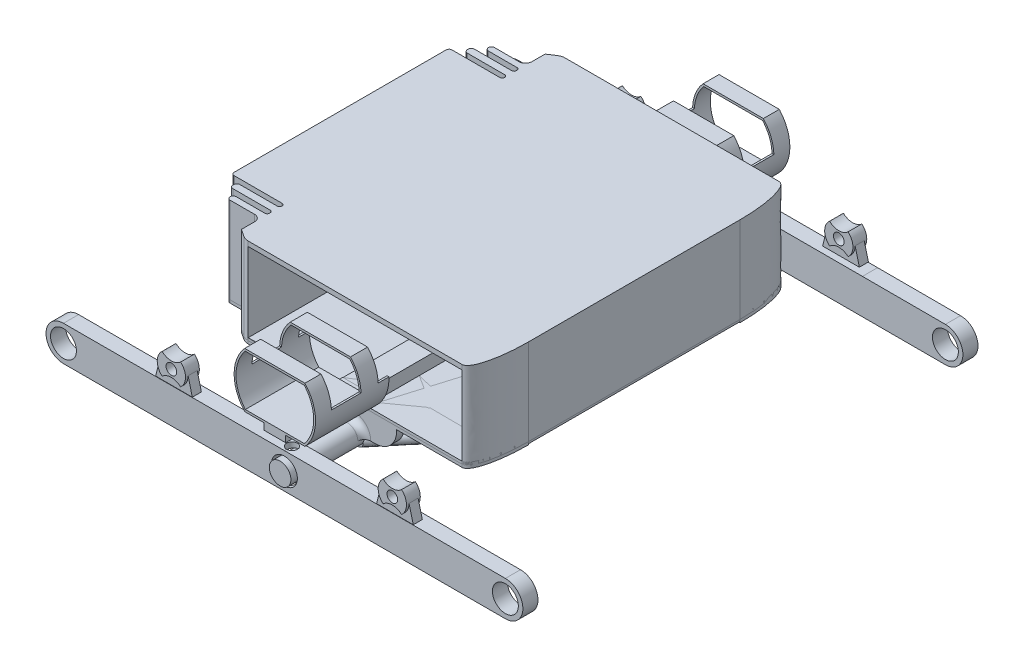
from build123d import *

# Parameters (mm, degrees)
ESQUISSE2_R                = 0.6
BOSS_EXTRU_1_DEPTH         = 0.7
BOSS_EXTRU_2_DEPTH         = 2.5
BOSS_EXTRU_2_DEPTH_BACK    = 0.9
ESQUISSE3_R                = 0.5
BOSS_EXTRU_3_DEPTH         = 0.35
ESQUISSE5_R                = 0.440819729
ESQUISSE5_R_2              = 0.424922346
ESQUISSE5_R_3              = 0.414901945
BOSS_EXTRU_4_DEPTH         = 0.25
BOSS_EXTRU_5_DEPTH         = 4.9
ESQUISSE7_W                = 8.542335337
ESQUISSE7_H                = 0.422043951
ENL_V_MAT_EXTRU_1_DEPTH    = 14.9
ESQUISSE8_R                = 0.25
ENL_V_MAT_EXTRU_2_DEPTH    = 8.9
CONG_5_R                   = 0.3
CONG_6_R                   = 0.3
ESQUISSE9_W                = 1
ESQUISSE9_H                = 0.991396237
BOSS_EXTRU_6_DEPTH         = 3.3
ESQUISSE10_W               = 1
ESQUISSE10_H               = 4.872746141
BOSS_EXTRU_7_DEPTH         = 0.3
CONG_7_R                   = 0.65
BOSS_EXTRU_8_DEPTH         = 3.4
ESQUISSE12_W               = 5.073279631
ESQUISSE12_H               = 1.081690251
ESQUISSE12_H_2             = 1.371156657
ENL_V_MAT_EXTRU_3_DEPTH    = 1.2
ESQUISSE13_W               = 1.287286083
ESQUISSE13_H               = 2.982685344
ENL_V_MAT_EXTRU_4_DEPTH    = 15
R_P_TITION_LIN_AIRE1_COUNT = 2
R_P_TITION_LIN_AIRE1_PITCH = 3
ESQUISSE14_W               = 5.115977828
ESQUISSE14_H               = 3.310338595
ENL_V_MAT_EXTRU_5_DEPTH    = 23
BOSS_EXTRU_9_DEPTH         = 0.42
BOSS_EXTRU_10_DEPTH        = 0.12
BOSS_EXTRU_10_DEPTH_BACK   = 0.52
ESQUISSE15_3_R             = 0.247393685
ESQUISSE16_W               = 12.655877587
ESQUISSE16_H               = 0.015278066
ENL_V_MAT_EXTRU_6_DEPTH    = 0.82
ESQUISSE20_R               = 0.236647014
SYM_TRIE7_COPY_1_SKETCH_R  = 0.236647014
BOSS_EXTRUDE2_START        = 2
BOSS_EXTRUDE2_DEPTH        = 4
CUT_EXTRUDE1_DEPTH         = 14.8


with BuildPart() as part:
    # Esquisse2 → Boss.-Extru.1 (new body)
    with BuildSketch(Plane.XY):
        with BuildLine():
            Line((-10.236323587, 0), (10.236323587, 0))
            ThreePointArc((10.236323587, 0), (11.046163138, 0.80983955), (10.236323587, 1.619679101))
            Line((10.236323587, 1.619679101), (0, 1.629847733))
            Line((0, 1.629847733), (-10.236323587, 1.619679101))
            ThreePointArc((-10.236323587, 1.619679101), (-11.046163138, 0.80983955), (-10.236323587, 0))
        make_face()
        with Locations((-10.236323587, 0.80983955)):
            Circle(ESQUISSE2_R, mode=Mode.SUBTRACT)
        with Locations(Location((10.236323587, 0.80983955, 0), (0, 0, 180))):
            Circle(ESQUISSE2_R, mode=Mode.SUBTRACT)
        with Locations((0, 0.80983955)):
            Circle(ESQUISSE2_R, mode=Mode.SUBTRACT)
    extrude(amount=BOSS_EXTRU_1_DEPTH)


with BuildPart() as body_2:
    # Esquisse3 → Boss.-Extru.2 (new, two sides: drawn at the far end of the back side and taken through both)
    with BuildSketch(Plane(origin=(0, 0, 0), x_dir=(-1, 0, 0), z_dir=(0, 0, -1)).offset(-BOSS_EXTRU_2_DEPTH_BACK)):
        with Locations((0, 0.80983955)):
            Circle(ESQUISSE3_R)
    extrude(amount=BOSS_EXTRU_2_DEPTH + BOSS_EXTRU_2_DEPTH_BACK)

    # Esquisse4 → Boss.-Extru.3 (add)
    with BuildSketch(Plane(origin=(0, 0, -2.5), x_dir=(-1, 0, 0), z_dir=(0, 0, -1))):
        with BuildLine():
            Line((-1.000360815, 0.80983955), (1.000360815, 0.80983955))
            ThreePointArc((1.000360815, 0.80983955), (1.707467596, 1.102732769), (2.000360815, 1.80983955))
            Line((2.000360815, 1.80983955), (2.000360815, 1.868488265))
            Line((2.000360815, 1.868488265), (-2.000360815, 1.868488265))
            Line((-2.000360815, 1.868488265), (-2.000360815, 1.80983955))
            ThreePointArc((-2.000360815, 1.80983955), (-1.707467596, 1.102732769), (-1.000360815, 0.80983955))
        make_face()
    extrude(amount=BOSS_EXTRU_3_DEPTH)

    # Esquisse5 → Boss.-Extru.4 (add)
    with BuildSketch(Plane(origin=(0, 1.868488265, 0), x_dir=(1, 0, 0), z_dir=(0, 1, 0))):
        with BuildLine():
            Line((-4.881439513, 2.5), (5.030716995, 2.5))
            add(Edge.make_bspline(
                [(5.030716995, 2.5), (5.66183981, 2.5), (5.66183981, 4.942623645)],
                knots=[0, 0, 0, 1.570796327, 1.570796327, 1.570796327], degree=2, weights=[1, 0.707106781, 1]))
            Line((5.66183981, 4.942623645), (5.030716995, 4.942623645))
            Line((5.030716995, 4.942623645), (-5.030716995, 4.942623645))
            Line((-5.030716995, 4.942623645), (-7.961856013, 4.942623645))
            Line((-7.961856013, 4.942623645), (-7.961856013, 4.937129036))
            ThreePointArc((-7.961856013, 4.937129036), (-7.920850963, 4.838134087), (-7.821856013, 4.797129036))
            Line((-7.821856013, 4.797129036), (-5.601472233, 4.797129036))
            ThreePointArc((-5.601472233, 4.797129036), (-5.530761555, 4.767839714), (-5.501472233, 4.697129036))
            Line((-5.501472233, 4.697129036), (-5.501472233, 4.672436453))
            ThreePointArc((-5.501472233, 4.672436453), (-5.530761555, 4.601725775), (-5.601472233, 4.572436453))
            Line((-5.601472233, 4.572436453), (-7.338766961, 4.572436453))
            ThreePointArc((-7.338766961, 4.572436453), (-7.43776191, 4.531431403), (-7.478766961, 4.432436453))
            Line((-7.478766961, 4.432436453), (-7.478766961, 4.386632208))
            ThreePointArc((-7.478766961, 4.386632208), (-7.43776191, 4.287637259), (-7.338766961, 4.246632208))
            Line((-7.338766961, 4.246632208), (-5.601472233, 4.246632208))
            ThreePointArc((-5.601472233, 4.246632208), (-5.530761555, 4.217342886), (-5.501472233, 4.146632208))
            Line((-5.501472233, 4.146632208), (-5.501472233, 4.099470367))
            ThreePointArc((-5.501472233, 4.099470367), (-5.530761555, 4.028759689), (-5.601472233, 3.999470367))
            Line((-5.601472233, 3.999470367), (-6.934320312, 3.999470367))
            ThreePointArc((-6.934320312, 3.999470367), (-7.033315261, 3.958465317), (-7.074320312, 3.858604639))
            ThreePointArc((-7.074320312, 3.858604639), (-7.033315261, 3.75960969), (-6.934320312, 3.718604639))
            Line((-6.934320312, 3.718604639), (-5.801472233, 3.718604639))
            ThreePointArc((-5.801472233, 3.718604639), (-5.589340198, 3.630736673), (-5.501472233, 3.418604639))
            Line((-5.501472233, 3.418604639), (-5.501472233, 2.808599679))
            Line((-5.501472233, 2.808599679), (-5.15556067, 2.581840232))
            ThreePointArc((-5.15556067, 2.581840232), (-5.024478173, 2.520896731), (-4.881439513, 2.5))
        make_face()
        with Locations(Location((4.399594181, 4.246632208, 0), (0, 0, 270))):
            Circle(ESQUISSE5_R, mode=Mode.SUBTRACT)
        with Locations(Location((1.923651751, 4.246632208, 0), (0, 0, 270))):
            Circle(ESQUISSE5_R_2, mode=Mode.SUBTRACT)
        with Locations(Location((-0.571105002, 4.246632208, 0), (0, 0, 270))):
            Circle(ESQUISSE5_R_3, mode=Mode.SUBTRACT)
    extrude(amount=BOSS_EXTRU_4_DEPTH)

    # Esquisse6 → Boss.-Extru.5 (add)
    with BuildSketch(Plane(origin=(0, 0, -4.942623645), x_dir=(-1, 0, 0), z_dir=(0, 0, -1))):
        with BuildLine():
            Line((7.961856013, 2.114509784), (7.961856013, 1.91584809))
            add(Edge.make_bspline(
                [(-5.66183981, 1.911930194), (1.281749448, 0.540694096), (7.961856013, 1.91584809)],
                knots=[3.412040127, 3.412040127, 3.412040127, 6.023242926, 6.023242926, 6.023242926], degree=2, weights=[1, 0.262097386, 1]))
            Line((-5.66183981, 1.911930194), (-5.66183981, 2.11842768))
            add(Edge.make_bspline(
                [(7.961856013, 2.114509784), (1.281749448, 3.489663779), (-5.66183981, 2.11842768)],
                knots=[0.259942381, 0.259942381, 0.259942381, 2.87114518, 2.87114518, 2.87114518], degree=2, weights=[1, 0.262097386, 1]))
        make_face()
    extrude(amount=BOSS_EXTRU_5_DEPTH)


with BuildPart() as body_3:
    # Symétrie2: mirrored copy
    add(part.part.mirror(Plane(origin=(-1.140290579, 2.015178937, -9.842623645), x_dir=(1, 0, 0), z_dir=(0, 0, -1))))


with BuildPart() as body_4:
    # Sym_trie2 2: mirrored copy
    add(body_2.part.mirror(Plane(origin=(-1.140290579, 2.015178937, -9.842623645), x_dir=(1, 0, 0), z_dir=(0, 0, -1))))


with BuildPart() as enl_v_mat_extru_1_tool:
    # Esquisse7 → Enlèv. mat.-Extru.1 (new body)
    with BuildSketch(Plane(origin=(5.66183981, 0, 0), x_dir=(0, 0, -1), z_dir=(1, 0, 0))):
        with Locations((9.842623644, 2.476029897)):
            Rectangle(ESQUISSE7_W, ESQUISSE7_H)
    extrude(amount=-ENL_V_MAT_EXTRU_1_DEPTH)


with BuildPart() as body_2_1:
    add(body_2.part)

    # Enlèv. mat.-Extru.1: cut by enl_v_mat_extru_1_tool
    add(enl_v_mat_extru_1_tool.part, mode=Mode.SUBTRACT)


with BuildPart() as body_4_1:
    add(body_4.part)

    # Enlèv. mat.-Extru.1: cut by enl_v_mat_extru_1_tool
    add(enl_v_mat_extru_1_tool.part, mode=Mode.SUBTRACT)


with BuildPart() as enl_v_mat_extru_2_tool:
    # Esquisse8 → Enlèv. mat.-Extru.2 (new body)
    with BuildSketch(Plane(origin=(-0.001619068, 1.629846125, 0), x_dir=(0.9999995065913634, 0.0009933866466951037, 0), z_dir=(-0.0009933866466951037, 0.9999995065913634, 0))):
        with Locations(Location((0.001619069, -0.35, 0), (0, 0, 180))):
            Circle(ESQUISSE8_R)
        with Locations(Location((0.001619069, 20.035247289, 0), (0, 0, 180))):
            Circle(ESQUISSE8_R)
    extrude(amount=-ENL_V_MAT_EXTRU_2_DEPTH)


with BuildPart() as part_1:
    add(part.part)

    # Enlèv. mat.-Extru.2: cut by enl_v_mat_extru_2_tool
    add(enl_v_mat_extru_2_tool.part, mode=Mode.SUBTRACT)


with BuildPart() as body_2_2:
    add(body_2_1.part)

    # Enlèv. mat.-Extru.2: cut by enl_v_mat_extru_2_tool
    add(enl_v_mat_extru_2_tool.part, mode=Mode.SUBTRACT)

    # Congé5
    # the kernel refuses this fillet: 0.3 mm, written as the material it adds along each edge
    with BuildSketch(Plane(origin=(0, 0.80983955, -2.5), x_dir=(-1, 0, 0), z_dir=(0, -1, 0))) as cong_5_piece_1:
        with BuildLine():
            CenterArc((0.5 + CONG_5_R, -CONG_5_R), CONG_5_R, 90, 90)
            Line((0.5 + CONG_5_R, 0), (0.5, 0))
            Line((0.5, 0), (0.5, -CONG_5_R))
        make_face()
    revolve(axis=Axis((0, 0.80983955, -2.5), (0, 0, -1)), revolution_arc=180)



with BuildPart() as body_3_1:
    add(body_3.part)

    # Enlèv. mat.-Extru.2: cut by enl_v_mat_extru_2_tool
    add(enl_v_mat_extru_2_tool.part, mode=Mode.SUBTRACT)

    # Esquisse15 → Boss.-Extru.9 (add)
    with BuildSketch(Plane(origin=(0, 0, -20.385247289), x_dir=(-1, 0, 0), z_dir=(0, 0, -1))):
        with BuildLine():
            Line((-5.972812975, 1.623914418), (-4.263947142, 1.625611983))
            Line((-4.263947142, 1.625611983), (-4.462617486, 2.39819621))
            ThreePointArc((-4.462617486, 2.39819621), (-4.52250409, 2.124462325), (-4.691222138, 1.900741819))
            ThreePointArc((-4.691222138, 1.900741819), (-5.118161794, 2.066734394), (-5.545101449, 1.900741819))
            ThreePointArc((-5.545101449, 1.900741819), (-5.713819498, 2.124462325), (-5.773706102, 2.39819621))
            Line((-5.773706102, 2.39819621), (-5.972812975, 1.623914418))
        make_face()
        with BuildLine():
            Line((5.972812975, 1.623914418), (5.773706102, 2.39819621))
            ThreePointArc((5.773706102, 2.39819621), (5.713819498, 2.124462325), (5.545101449, 1.900741819))
            ThreePointArc((5.545101449, 1.900741819), (5.118161794, 2.066734394), (4.691222138, 1.900741819))
            ThreePointArc((4.691222138, 1.900741819), (4.52250409, 2.124462325), (4.462617486, 2.39819621))
            Line((4.462617486, 2.39819621), (4.263947142, 1.625611983))
            Line((4.263947142, 1.625611983), (5.972812975, 1.623914418))
        make_face()
    extrude(amount=-BOSS_EXTRU_9_DEPTH)

    # Esquisse15<3> → Boss.-Extru.10 (add, two sides: drawn at the far end of the back side and taken through both)
    # profile 1 of 2: a face of its own
    with BuildSketch(Plane(origin=(0, 0, -20.385247289), x_dir=(-1, 0, 0), z_dir=(0, 0, -1)).offset(-BOSS_EXTRU_10_DEPTH_BACK)):
        with BuildLine():
            ThreePointArc((-5.545101449, 1.900741819), (-5.773706102, 2.39819621), (-5.545101449, 2.8956506))
            ThreePointArc((-5.545101449, 2.8956506), (-5.118161794, 2.729658025), (-4.691222138, 2.8956506))
            ThreePointArc((-4.691222138, 2.8956506), (-4.462617486, 2.39819621), (-4.691222138, 1.900741819))
            ThreePointArc((-4.691222138, 1.900741819), (-5.118161794, 2.066734394), (-5.545101449, 1.900741819))
        make_face()
        with Locations((-5.118161794, 2.39819621)):
            Circle(ESQUISSE15_3_R, mode=Mode.SUBTRACT)
    # profile 2 of 2: a face of its own
    with BuildSketch(Plane(origin=(0, 0, -20.385247289), x_dir=(-1, 0, 0), z_dir=(0, 0, -1)).offset(-BOSS_EXTRU_10_DEPTH_BACK)):
        with BuildLine():
            ThreePointArc((5.545101449, 2.8956506), (5.118161794, 2.729658025), (4.691222138, 2.8956506))
            ThreePointArc((4.691222138, 2.8956506), (4.462617486, 2.39819621), (4.691222138, 1.900741819))
            ThreePointArc((4.691222138, 1.900741819), (5.118161794, 2.066734394), (5.545101449, 1.900741819))
            ThreePointArc((5.545101449, 1.900741819), (5.773706102, 2.39819621), (5.545101449, 2.8956506))
        make_face()
        with Locations((5.118161794, 2.39819621)):
            Circle(ESQUISSE15_3_R, mode=Mode.SUBTRACT)
    extrude(amount=BOSS_EXTRU_10_DEPTH + BOSS_EXTRU_10_DEPTH_BACK)

    # Esquisse16 → Enlèv. mat.-Extru.6 (cut)
    with BuildSketch(Plane(origin=(0, 0, -20.385247289), x_dir=(-1, 0, 0), z_dir=(0, 0, -1))):
        with Locations((-0.06519047, 1.631135914)):
            Rectangle(ESQUISSE16_W, ESQUISSE16_H)
    extrude(amount=-ENL_V_MAT_EXTRU_6_DEPTH, mode=Mode.SUBTRACT)


with BuildPart() as body_4_2:
    add(body_4_1.part)

    # Enlèv. mat.-Extru.2: cut by enl_v_mat_extru_2_tool
    add(enl_v_mat_extru_2_tool.part, mode=Mode.SUBTRACT)

    # Congé6
    # the kernel refuses this fillet: 0.3 mm, written as the material it adds along each edge
    with BuildSketch(Plane(origin=(0, 0.80983955, -17.185247289), x_dir=(-1, 0, 0), z_dir=(0, -1, 0))) as cong_6_piece_1:
        with BuildLine():
            CenterArc((0.5 + CONG_6_R, CONG_6_R), CONG_6_R, 180, 90)
            Line((0.5, CONG_6_R), (0.5, 0))
            Line((0.5, 0), (0.5 + CONG_6_R, 0))
        make_face()
    revolve(axis=Axis((0, 0.80983955, -17.185247289), (0, 0, -1)), revolution_arc=180)


with BuildPart() as body_2_3:
    add(body_2_2.part)

    add(body_4_2.part)  # Boss.-Extru.6 merges body 4
    # Esquisse9 → Boss.-Extru.6 (add)
    with BuildSketch(Plane(origin=(0, 2.118488265, 0), x_dir=(1, 0, 0), z_dir=(0, 1, 0))):
        with Locations((0, 3.232297071)):
            Rectangle(ESQUISSE9_W, ESQUISSE9_H)
        with Locations((0, 16.452950218)):
            Rectangle(ESQUISSE9_W, ESQUISSE9_H)
    extrude(amount=BOSS_EXTRU_6_DEPTH)

    # Esquisse10 → Boss.-Extru.7 (add)
    with BuildSketch(Plane(origin=(0, 5.418488265, 0), x_dir=(1, 0, 0), z_dir=(0, 1, 0))):
        with Locations((0, 1.291622118)):
            Rectangle(ESQUISSE10_W, ESQUISSE10_H)
        with Locations((0, 18.393625171)):
            Rectangle(ESQUISSE10_W, ESQUISSE10_H)
    extrude(amount=BOSS_EXTRU_7_DEPTH)

    # Congé7
    cong_7_edges = [body_2_3.edges().sort_by_distance(p)[0] for p in [
        (0, 5.718488265, -3.727995189),
        (0, 5.718488265, -15.9572521),
    ]]
    fillet(cong_7_edges, radius=CONG_7_R)

    # Esquisse11 → Boss.-Extru.8 (add)
    with BuildSketch(Plane.XY.offset(1.144750952)):
        with BuildLine():
            Line((-1.396030261, 5.718488265), (-1.277502313, 5.718488265))
            Line((-1.277502313, 5.718488265), (-0.5, 5.718488265))
            Line((-0.5, 5.718488265), (0, 5.718488265))
            Line((0, 5.718488265), (0.5, 5.718488265))
            Line((0.5, 5.718488265), (1.277502313, 5.718488265))
            Line((1.277502313, 5.718488265), (1.396030261, 5.718488265))
            ThreePointArc((1.396030261, 5.718488265), (1.885971455, 6.986552869), (1.396030261, 8.254617473))
            Line((1.396030261, 8.254617473), (1.277502313, 8.254617473))
            Line((1.277502313, 8.254617473), (-1.277502313, 8.254617473))
            Line((-1.277502313, 8.254617473), (-1.396030261, 8.254617473))
            ThreePointArc((-1.396030261, 8.254617473), (-1.885971455, 6.986552869), (-1.396030261, 5.718488265))
        make_face()
        with BuildLine():
            Line((1.367881574, 5.816552869), (-1.367881574, 5.816552869))
            ThreePointArc((-1.367881574, 5.816552869), (-1.8, 6.986552869), (-1.367881574, 8.156552869))
            Line((-1.367881574, 8.156552869), (1.367881574, 8.156552869))
            ThreePointArc((1.367881574, 8.156552869), (1.8, 6.986552869), (1.367881574, 5.816552869))
        make_face(mode=Mode.SUBTRACT)
    boss_extru_8 = extrude(amount=-BOSS_EXTRU_8_DEPTH)

    # Esquisse12 → Enlèv. mat.-Extru.3 (cut)
    with BuildSketch(Plane(origin=(0, 8.254617473, 0), x_dir=(1, 0, 0), z_dir=(0, 1, 0))):
        with Locations((0.038821431, 2.297263543)):
            Rectangle(ESQUISSE12_W, ESQUISSE12_H)
        with Locations((0.038821431, 0.278616242)):
            Rectangle(ESQUISSE12_W, ESQUISSE12_H_2)
    enl_v_mat_extru_3 = extrude(amount=-ENL_V_MAT_EXTRU_3_DEPTH, mode=Mode.SUBTRACT)

    # Symétrie3: Boss.-Extru.8, Enlèv. mat.-Extru.3 across plane
    add(boss_extru_8.mirror(Plane.XY.offset(-9.842623645)))
    add(enl_v_mat_extru_3.mirror(Plane.XY.offset(-9.842623645)), mode=Mode.SUBTRACT)

    # Esquisse13 → Enlèv. mat.-Extru.4 (cut)
    with BuildSketch(Plane(origin=(0, 0, -16.948648337), x_dir=(-1, 0, 0), z_dir=(0, 0, -1))):
        with Locations((-0.071150859, 3.927145593)):
            Rectangle(ESQUISSE13_W, ESQUISSE13_H)
    extrude(amount=-ENL_V_MAT_EXTRU_4_DEPTH, mode=Mode.SUBTRACT)


with BuildPart() as enl_v_mat_extru_4_piece_1:
    # of the separate pieces the step leaves, piece 1, a body of its own (enl_v_mat_extru_4_pieces)
    add(body_2_3.part.solids().sort_by_distance((-0.5, 2.435802921, -15.9572521))[0])

    # Balayage1: sweep along a path in Esquisse19
    with BuildLine(Plane(origin=(-8.638992187, 0, -7.248975158), x_dir=(-0.6427876096865406, 0, 0.7660444431189771), z_dir=(-0.766044443118977, 1.046969667931511e-15, -0.6427876096865405))) as balayage1_path:
        Line((-12.970882069, 0.488386982), (-10.590021793, 0.488386982))
        ThreePointArc((-10.590021793, 0.488386982), (-10.095047047, 0.693412235), (-9.890021793, 1.188386982))
        Line((-9.890021793, 1.188386982), (-9.890021793, 1.632958309))
    # Esquisse20 → Balayage1 (sweep)
    with BuildSketch(Plane(origin=(0, 0, -17.185247289), x_dir=(-1, 0, 0), z_dir=(0, 0, -1))):
        with Locations((0.208920096, 0.535984275)):
            Circle(ESQUISSE20_R)
    balayage1 = sweep(path=balayage1_path.line)

    # Symétrie6: Balayage1 across plane
    add(balayage1.mirror(Plane(origin=(0, 0, 0), x_dir=(0, 0, 1), z_dir=(1, 0, 0))))

    # Symétrie7: Balayage1 across plane
    add(balayage1.mirror(Plane.XY.offset(-9.842623645)))

    # Symétrie7 copy 1: sweep along a path in Symétrie7 copy 1 path
    with BuildLine(Plane(origin=(8.638992187, 0, -12.436272131), x_dir=(0.6427876096865405, 0, -0.7660444431189772), z_dir=(0.7660444431189771, 1.046969667931511e-15, 0.6427876096865404))) as sym_trie7_copy_1_path:
        Line((-12.970882069, 0.488386982), (-10.590021793, 0.488386982))
        ThreePointArc((-10.590021793, 0.488386982), (-10.095047047, 0.693412235), (-9.890021793, 1.188386982))
        Line((-9.890021793, 1.188386982), (-9.890021793, 1.632958309))
    # Symétrie7 copy 1 sketch → Symétrie7 copy 1 (sweep)
    with BuildSketch(Plane.XY.offset(-2.5)):
        with Locations((0.208920096, 0.535984275)):
            Circle(SYM_TRIE7_COPY_1_SKETCH_R)
    sweep(path=sym_trie7_copy_1_path.line)


with BuildPart() as enl_v_mat_extru_4_piece_2:
    # of the separate pieces the step leaves, piece 2, a body of its own (enl_v_mat_extru_4_pieces)
    add(body_2_3.part.solids().sort_by_distance((-0.5, 5.718488265, -17.429998241))[0])


with BuildPart() as enl_v_mat_extru_4_piece_3:
    # of the separate pieces the step leaves, piece 3, a body of its own (enl_v_mat_extru_4_pieces)
    add(body_2_3.part.solids().sort_by_distance((-0.5, 5.418488265, -3.625717746))[0])


with BuildPart() as r_p_tition_lin_aire1_1:
    # Répétition linéaire1: pattern copy
    add(enl_v_mat_extru_4_piece_2.part.moved(Location(Vector(0, -1, 0) * (1 * R_P_TITION_LIN_AIRE1_PITCH))))


with BuildPart() as r_p_tition_lin_aire1_2:
    # Répétition linéaire1: pattern copy
    add(enl_v_mat_extru_4_piece_3.part.moved(Location(Vector(0, -1, 0) * (1 * R_P_TITION_LIN_AIRE1_PITCH))))


with BuildPart() as enl_v_mat_extru_5_tool:
    # Esquisse14 → Enlèv. mat.-Extru.5 (new body)
    with BuildSketch(Plane.XY.offset(1.144750952)):
        with Locations((0.095250848, 6.991061545)):
            Rectangle(ESQUISSE14_W, ESQUISSE14_H)
    extrude(amount=-ENL_V_MAT_EXTRU_5_DEPTH)


with BuildPart() as enl_v_mat_extru_4_piece_2_1:
    add(enl_v_mat_extru_4_piece_2.part)

    # Enlèv. mat.-Extru.5: cut by enl_v_mat_extru_5_tool
    add(enl_v_mat_extru_5_tool.part, mode=Mode.SUBTRACT)


with BuildPart() as enl_v_mat_extru_4_piece_3_1:
    add(enl_v_mat_extru_4_piece_3.part)

    # Enlèv. mat.-Extru.5: cut by enl_v_mat_extru_5_tool
    add(enl_v_mat_extru_5_tool.part, mode=Mode.SUBTRACT)


with BuildPart() as enl_v_mat_extru_6_piece_1:
    # of the separate pieces the step leaves, piece 1, a body of its own (enl_v_mat_extru_6_pieces)
    add(body_3_1.part.solids().sort_by_distance((-10.236323587, 1.619679101, -20.385247289))[0])


with BuildPart() as enl_v_mat_extru_6_piece_2:
    # of the separate pieces the step leaves, piece 2, a body of its own (enl_v_mat_extru_6_pieces)
    add(body_3_1.part.solids().sort_by_distance((-5.968991584, 1.638774947, -20.385247289))[0])


with BuildPart() as enl_v_mat_extru_6_piece_3:
    # of the separate pieces the step leaves, piece 3, a body of its own (enl_v_mat_extru_6_pieces)
    add(body_3_1.part.solids().sort_by_distance((4.691222138, 1.900741819, -20.385247289))[0])


with BuildPart() as body_8:
    # Symétrie5: mirrored copy
    add(enl_v_mat_extru_6_piece_2.part.mirror(Plane.XY.offset(-9.842623645)))


with BuildPart() as body_9:
    # Sym_trie5 2: mirrored copy
    add(enl_v_mat_extru_6_piece_3.part.mirror(Plane.XY.offset(-9.842623645)))


with BuildPart() as body_10:
    # Sketch3 → Boss-Extrude2 (new body)
    with BuildSketch(Plane(origin=(0, 0, 0), x_dir=(1, 0, 0), z_dir=(0, 1, 0)).offset(BOSS_EXTRUDE2_START)):
        Polygon((5.661532924, 4.942623645), (5.66183981, 4.942623645), (5.66183981, 14.742623645), (5.661532924, 14.742623645), (-7.942114082, 14.742623645), (-7.961856013, 14.742623645), (-7.961856013, 4.942623645), (-7.942114082, 4.942623645), align=None)
        with BuildLine():
            Line((5.661532924, 14.742623645), (5.66183981, 14.742623645))
            add(Edge.make_bspline(
                [(5.66183981, 14.742623645), (5.66183981, 17.185247289), (5.030716995, 17.185247289)],
                knots=[4.71238898, 4.71238898, 4.71238898, 6.283185307, 6.283185307, 6.283185307], degree=2, weights=[1, 0.707106781, 1]))
            Line((5.030716995, 17.185247289), (-4.881439513, 17.185247289))
            ThreePointArc((-4.881439513, 17.185247289), (-5.024478173, 17.164350558), (-5.15556067, 17.103407057))
            Line((-5.15556067, 17.103407057), (-5.501472233, 16.87664761))
            Line((-5.501472233, 16.87664761), (-5.501472233, 16.26664265))
            ThreePointArc((-5.501472233, 16.26664265), (-5.589340198, 16.054510616), (-5.801472233, 15.96664265))
            Line((-5.801472233, 15.96664265), (-6.934320312, 15.96664265))
            ThreePointArc((-6.934320312, 15.96664265), (-7.033315261, 15.9256376), (-7.074320312, 15.82664265))
            Line((-7.074320312, 15.82664265), (-7.074320312, 15.825776922))
            ThreePointArc((-7.074320312, 15.825776922), (-7.033315261, 15.726781972), (-6.934320312, 15.685776922))
            Line((-6.934320312, 15.685776922), (-5.601472233, 15.685776922))
            ThreePointArc((-5.601472233, 15.685776922), (-5.530761555, 15.6564876), (-5.501472233, 15.585776922))
            Line((-5.501472233, 15.585776922), (-5.501472233, 15.538615081))
            ThreePointArc((-5.501472233, 15.538615081), (-5.530761555, 15.467904403), (-5.601472233, 15.438615081))
            Line((-5.601472233, 15.438615081), (-7.338766961, 15.438615081))
            ThreePointArc((-7.338766961, 15.438615081), (-7.43776191, 15.39761003), (-7.478766961, 15.298615081))
            Line((-7.478766961, 15.298615081), (-7.478766961, 15.252810836))
            ThreePointArc((-7.478766961, 15.252810836), (-7.43776191, 15.153815887), (-7.338766961, 15.112810836))
            Line((-7.338766961, 15.112810836), (-5.601472233, 15.112810836))
            ThreePointArc((-5.601472233, 15.112810836), (-5.530761555, 15.083521514), (-5.501472233, 15.012810836))
            Line((-5.501472233, 15.012810836), (-5.501472233, 14.988118253))
            ThreePointArc((-5.501472233, 14.988118253), (-5.530761555, 14.917407575), (-5.601472233, 14.888118253))
            Line((-5.601472233, 14.888118253), (-7.821856013, 14.888118253))
            ThreePointArc((-7.821856013, 14.888118253), (-7.920850963, 14.847113203), (-7.961856013, 14.748118253))
            Line((-7.961856013, 14.748118253), (-7.961856013, 14.742623645))
            Line((-7.961856013, 14.742623645), (-7.942114082, 14.742623645))
            Line((-7.942114082, 14.742623645), (5.661532924, 14.742623645))
        make_face()
        with BuildLine():
            add(Edge.make_bspline(
                [(5.030716995, 2.5), (5.66183981, 2.5), (5.66183981, 4.942623645)],
                knots=[0, 0, 0, 1.570796327, 1.570796327, 1.570796327], degree=2, weights=[1, 0.707106781, 1]))
            Line((5.66183981, 4.942623645), (5.661532924, 4.942623645))
            Line((5.661532924, 4.942623645), (-7.942114082, 4.942623645))
            Line((-7.942114082, 4.942623645), (-7.961856013, 4.942623645))
            Line((-7.961856013, 4.942623645), (-7.961856013, 4.937129036))
            ThreePointArc((-7.961856013, 4.937129036), (-7.920850963, 4.838134087), (-7.821856013, 4.797129036))
            Line((-7.821856013, 4.797129036), (-5.601472233, 4.797129036))
            ThreePointArc((-5.601472233, 4.797129036), (-5.530761555, 4.767839714), (-5.501472233, 4.697129036))
            Line((-5.501472233, 4.697129036), (-5.501472233, 4.672436453))
            ThreePointArc((-5.501472233, 4.672436453), (-5.530761555, 4.601725775), (-5.601472233, 4.572436453))
            Line((-5.601472233, 4.572436453), (-7.338766961, 4.572436453))
            ThreePointArc((-7.338766961, 4.572436453), (-7.43776191, 4.531431403), (-7.478766961, 4.432436453))
            Line((-7.478766961, 4.432436453), (-7.478766961, 4.386632208))
            ThreePointArc((-7.478766961, 4.386632208), (-7.43776191, 4.287637259), (-7.338766961, 4.246632208))
            Line((-7.338766961, 4.246632208), (-5.601472233, 4.246632208))
            ThreePointArc((-5.601472233, 4.246632208), (-5.530761555, 4.217342886), (-5.501472233, 4.146632208))
            Line((-5.501472233, 4.146632208), (-5.501472233, 4.099470367))
            ThreePointArc((-5.501472233, 4.099470367), (-5.530761555, 4.028759689), (-5.601472233, 3.999470367))
            Line((-5.601472233, 3.999470367), (-6.934320312, 3.999470367))
            ThreePointArc((-6.934320312, 3.999470367), (-7.033315261, 3.958465317), (-7.074320312, 3.859470367))
            Line((-7.074320312, 3.859470367), (-7.074320312, 3.858604639))
            ThreePointArc((-7.074320312, 3.858604639), (-7.033315261, 3.75960969), (-6.934320312, 3.718604639))
            Line((-6.934320312, 3.718604639), (-5.801472233, 3.718604639))
            ThreePointArc((-5.801472233, 3.718604639), (-5.589340198, 3.630736673), (-5.501472233, 3.418604639))
            Line((-5.501472233, 3.418604639), (-5.501472233, 2.808599679))
            Line((-5.501472233, 2.808599679), (-5.15556067, 2.581840232))
            ThreePointArc((-5.15556067, 2.581840232), (-5.024478173, 2.520896731), (-4.881439513, 2.5))
            Line((-4.881439513, 2.5), (5.030716995, 2.5))
        make_face()
    extrude(amount=BOSS_EXTRUDE2_DEPTH)


with BuildPart() as cut_extrude1_tool:
    # Sketch4 → Cut-Extrude1 (new body)
    with BuildSketch(Plane.XY.offset(-2.5)):
        Polygon((-4.881439513, 5.779361461), (5.030716995, 5.779361461), (5.030716995, 2.118488265), (0.60372946, 2.118488265), (0.60372946, 2.716496411), (-0.49054076, 2.716496411), (-0.49054076, 2.118488265), (-4.881439513, 2.118488265), align=None)
    extrude(amount=-CUT_EXTRUDE1_DEPTH)


with BuildPart() as enl_v_mat_extru_4_piece_1_1:
    add(enl_v_mat_extru_4_piece_1.part)

    # Cut-Extrude1: cut by cut_extrude1_tool
    add(cut_extrude1_tool.part, mode=Mode.SUBTRACT)


with BuildPart() as r_p_tition_lin_aire1_1_1:
    add(r_p_tition_lin_aire1_1.part)

    # Cut-Extrude1: cut by cut_extrude1_tool
    add(cut_extrude1_tool.part, mode=Mode.SUBTRACT)


with BuildPart() as r_p_tition_lin_aire1_2_1:
    add(r_p_tition_lin_aire1_2.part)

    # Cut-Extrude1: cut by cut_extrude1_tool
    add(cut_extrude1_tool.part, mode=Mode.SUBTRACT)


with BuildPart() as body_10_1:
    add(body_10.part)

    # Cut-Extrude1: cut by cut_extrude1_tool
    add(cut_extrude1_tool.part, mode=Mode.SUBTRACT)


solid = Compound([part_1.part, enl_v_mat_extru_6_piece_1.part, enl_v_mat_extru_6_piece_2.part, enl_v_mat_extru_6_piece_3.part, body_8.part, body_9.part, enl_v_mat_extru_4_piece_1_1.part, r_p_tition_lin_aire1_1_1.part, r_p_tition_lin_aire1_2_1.part, body_10_1.part])
